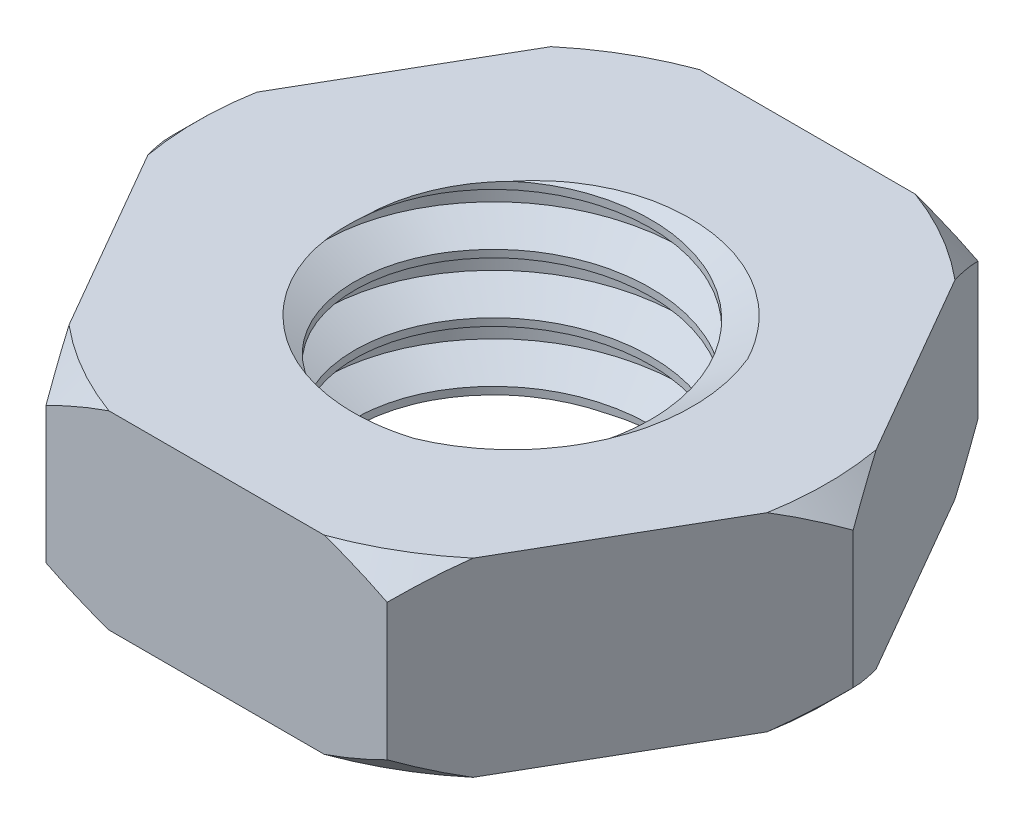
from build123d import *

# Parameters (mm, degrees)
SKETCH2_OUTSIDE_W  = 16.816
SKETCH2_OUTSIDE_H  = 16.816
CUT_EXTRUDE1_DEPTH = 10
THREAD1_PITCH      = 1


with BuildPart() as part:
    # Sketch1 → Revolve1 (revolve)
    with BuildSketch(Plane.XY, mode=Mode.PRIVATE) as revolve1_sk:
        Polygon((5.75, 2.75), (5.75, 0.45), (5.3, 0), (2.5, 0), (2.5, 3.2), (5.3, 3.2), align=None)
    revolve(revolve1_sk.sketch.rotate(Axis((0, 3.2, 0), (0, -1, 0)), 180), axis=Axis((0, 3.2, 0), (0, -1, 0)))

    # Sketch2 outside → Cut-Extrude1 (cut)
    with BuildSketch(Plane(origin=(0, 3.2, 0), x_dir=(1, 0, 0), z_dir=(0, 1, 0))):
        Rectangle(SKETCH2_OUTSIDE_W, SKETCH2_OUTSIDE_H)
        Polygon((-2.875, 4.979646072), (-5.75, 0), (-2.875, -4.979646072), (2.875, -4.979646072), (5.75, 0), (2.875, 4.979646072), align=None, mode=Mode.SUBTRACT)
    extrude(amount=-CUT_EXTRUDE1_DEPTH, mode=Mode.SUBTRACT)

    # Thread1: the profile of Thread Profile1 profile screwed along a right-hand helix of 4.2 turns, 8 arcs to a turn; built about Z, then put on its axis
    thread1_z = Axis((0, 0, 0), (0, 0, 1))
    thread1_corners = [(2.4997, 0, -0.000173205), (2.4997, 0, 0.875173202), (3.041265875, 0, 0.562499999), (3.041265875, 0, 0.312499999)]
    with BuildLine(mode=Mode.PRIVATE) as thread1_profile:
        Line(thread1_corners[0], thread1_corners[1])
        Line(thread1_corners[1], thread1_corners[2])
        Line(thread1_corners[2], thread1_corners[3])
        Line(thread1_corners[3], thread1_corners[0])
    thread1_cap = Face(thread1_profile.wire())
    thread1_turn_angles = [0, 22.5, 45, 67.5, 90, 112.5, 135, 157.5, 180, 202.5, 225, 247.5, 270, 292.5, 315, 337.5, 360]
    thread1_turn_weights = [1, 0.9238795325112867, 1, 0.9238795325112867, 1, 0.9238795325112867, 1, 0.9238795325112867, 1, 0.9238795325112867, 1, 0.9238795325112867, 1, 0.9238795325112867, 1, 0.9238795325112867, 1]
    thread1_turn_rails = [Edge.make_bspline([Vector(p[0], p[1], 0).rotate(thread1_z, thread1_turn_angles[k]) / thread1_turn_weights[k] + Vector(0, 0, p[2] + THREAD1_PITCH * thread1_turn_angles[k] / 360) for k in range(17)], [0, 0, 0, 1, 1, 2, 2, 3, 3, 4, 4, 5, 5, 6, 6, 7, 7, 8, 8, 8], 2, thread1_turn_weights) for p in thread1_corners]
    thread1_turn_sides = [Face.make_surface_from_curves(thread1_turn_rails[p[0]], thread1_turn_rails[p[1]]) for p in [(0, 1), (1, 2), (2, 3), (3, 0)]]
    thread1_last_angles = [1440, 1462.5, 1485, 1498.5, 1512]
    thread1_last_weights = [1, 0.9238795325112867, 1, 0.9723699203976766, 1]
    thread1_last_rails = [Edge.make_bspline([Vector(p[0], p[1], 0).rotate(thread1_z, thread1_last_angles[k]) / thread1_last_weights[k] + Vector(0, 0, p[2] + THREAD1_PITCH * thread1_last_angles[k] / 360) for k in range(5)], [0, 0, 0, 1, 1, 2, 2, 2], 2, thread1_last_weights) for p in thread1_corners]
    thread1_last_sides = [Face.make_surface_from_curves(thread1_last_rails[p[0]], thread1_last_rails[p[1]]) for p in [(0, 1), (1, 2), (2, 3), (3, 0)]]
    thread1 = Plane(origin=(0, 4.2, 0), x_dir=(-1, 0, 0), z_dir=(0, -1, 0)) * Solid(Shell([*[p.moved(Location((0, 0, THREAD1_PITCH * i))) for i in range(4) for p in thread1_turn_sides], *thread1_last_sides, thread1_cap, thread1_cap.rotate(thread1_z, 1512).moved(Location((0, 0, THREAD1_PITCH * 1512 / 360)))]))
    add(thread1, mode=Mode.SUBTRACT)


solid = part.part
